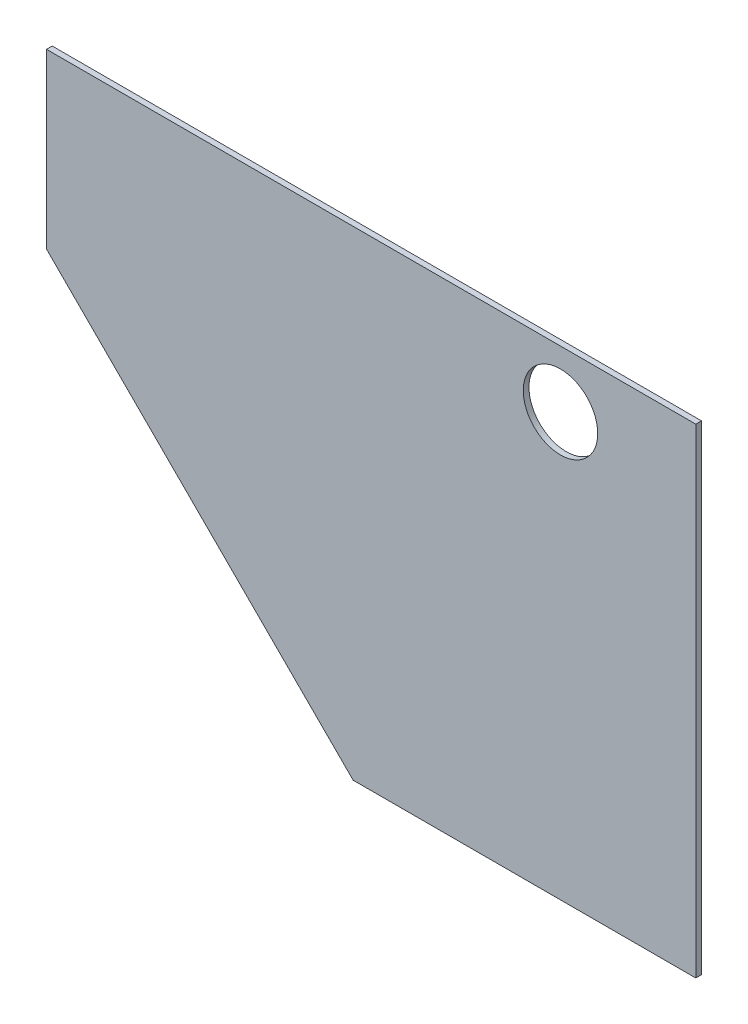
from build123d import *

# Parameters (mm, degrees)
SKETCH1_R           = 20.701
BOSS_EXTRUDE1_DEPTH = 3.175


with BuildPart() as part:
    # Sketch1 → Boss-Extrude1 (new body)
    with BuildSketch(Plane.XY):
        Polygon((-138.259383474, 48.991487021), (32.210627804, -121.478524257), (222.710627804, -121.478524257), (222.710627804, 145.221475743), (-138.259383474, 145.221475743), align=None)
        with Locations((147.490616526, 113.471475743)):
            Circle(SKETCH1_R, mode=Mode.SUBTRACT)
    extrude(amount=BOSS_EXTRUDE1_DEPTH)


solid = part.part
